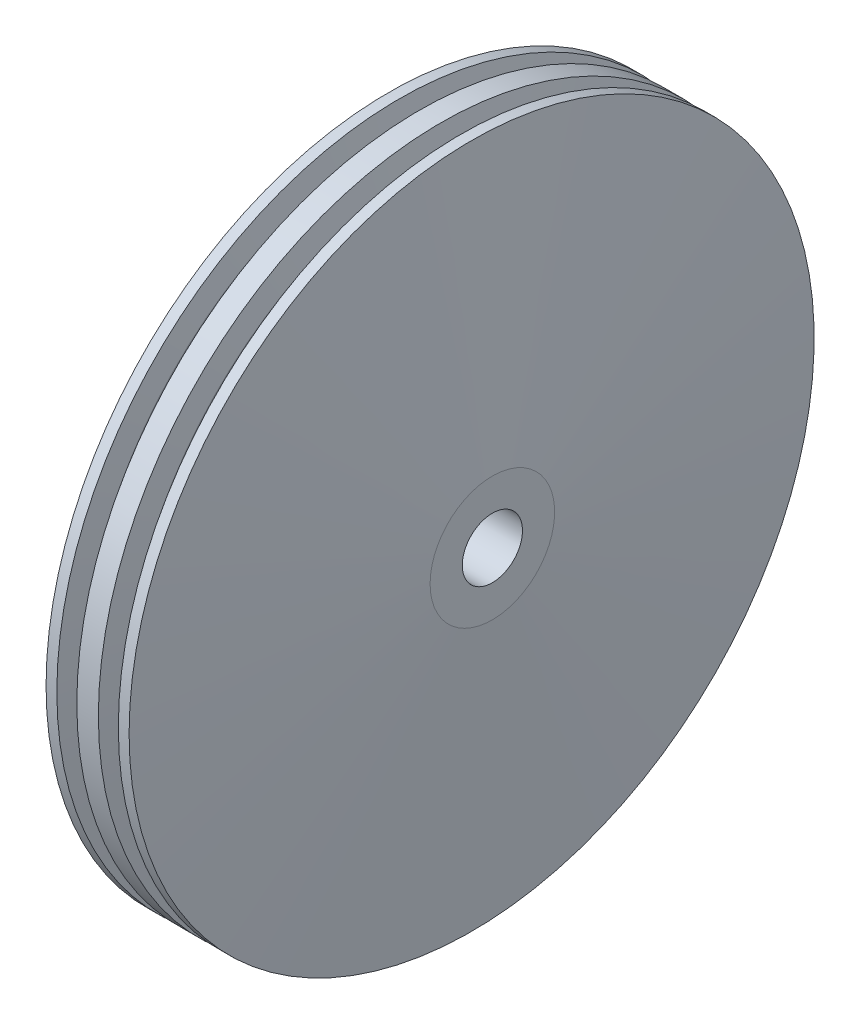
from build123d import *


with BuildPart() as part:
    # Esquisse1 → Révolution1 (revolve)
    with BuildSketch(Plane.XY):
        with BuildLine():
            Line((1.7, 2.9), (1.7, 1.5))
            Line((1.7, 1.5), (-2.3, 1.5))
            Line((-2.3, 1.5), (-2.3, 2.9))
            Line((-2.3, 2.9), (-6, 2.9))
            Line((-6, 2.9), (-6, 6))
            Line((-6, 6), (-4, 33))
            Line((-4, 33), (-2.961909929, 33))
            Line((-2.961909929, 33), (-2.590884652, 30.895811093))
            ThreePointArc((-2.590884652, 30.895811093), (-2, 30.4), (-1.409115348, 30.895811093))
            Line((-1.409115348, 30.895811093), (-1.038090071, 33))
            Line((-1.038090071, 33), (1.038090071, 33))
            Line((1.038090071, 33), (1.409115348, 30.895811093))
            ThreePointArc((1.409115348, 30.895811093), (2, 30.4), (2.590884652, 30.895811093))
            Line((2.590884652, 30.895811093), (2.961909929, 33))
            Line((2.961909929, 33), (4, 33))
            Line((4, 33), (6, 6))
            Line((6, 6), (6, 2.9))
            Line((6, 2.9), (1.7, 2.9))
        make_face()
    revolve(axis=Axis((-34.867117454, 0, 0), (1, 0, 0)))


solid = part.part
